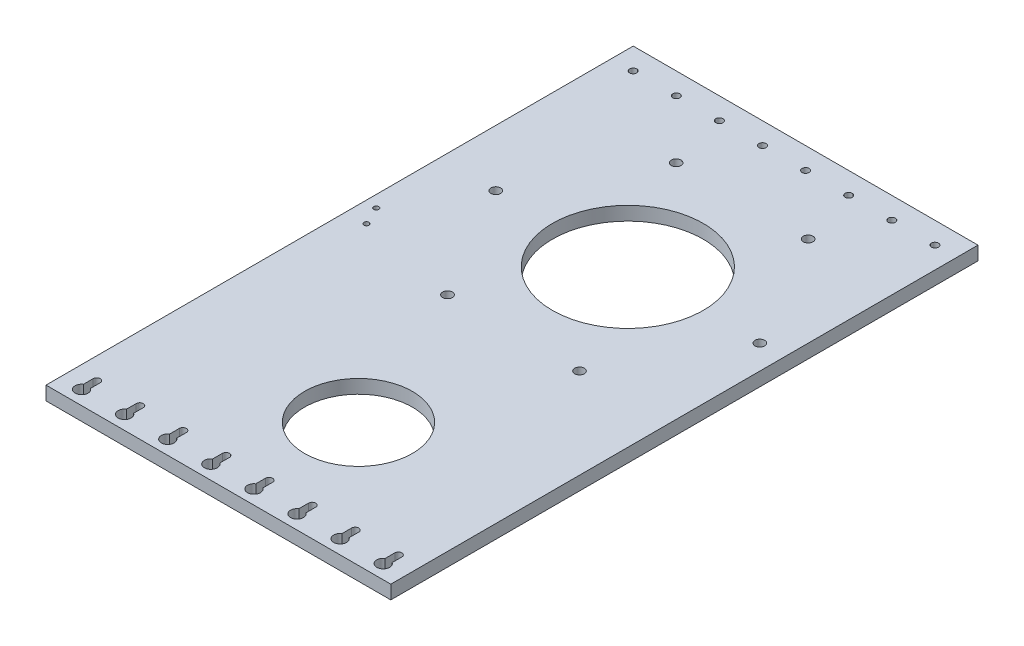
from build123d import *

# Parameters (mm, degrees)
SKETCH1_W           = 160
SKETCH1_H           = 272.5
SKETCH1_R           = 2.25
SKETCH1_R_2         = 25
SKETCH1_R_3         = 1.175
SKETCH1_R_4         = 1.65
SKETCH1_R_5         = 35
BOSS_EXTRUDE1_DEPTH = 6.35
CUT_EXTRUDE1_REACH  = 318.064
SKETCH2_R           = 3


with BuildPart() as part:
    # Sketch1 → Boss-Extrude1 (new body)
    with BuildSketch(Plane(origin=(0, 0, 0), x_dir=(1, 0, 0), z_dir=(0, 1, 0))):
        with Locations((80, 136.25)):
            Rectangle(SKETCH1_W, SKETCH1_H)
        with BuildLine():
            ThreePointArc((11.65, 6.5), (10, 4.85), (8.35, 6.5))
            Line((8.35, 6.5), (8.35, 13.5))
            ThreePointArc((8.35, 13.5), (10, 15.15), (11.65, 13.5))
            Line((11.65, 13.5), (11.65, 6.5))
        make_face(mode=Mode.SUBTRACT)
        with BuildLine():
            Line((31.65, 13.5), (31.65, 6.5))
            ThreePointArc((31.65, 6.5), (30, 4.85), (28.35, 6.5))
            Line((28.35, 6.5), (28.35, 13.5))
            ThreePointArc((28.35, 13.5), (30, 15.15), (31.65, 13.5))
        make_face(mode=Mode.SUBTRACT)
        with BuildLine():
            Line((51.65, 13.5), (51.65, 6.5))
            ThreePointArc((51.65, 6.5), (50, 4.85), (48.35, 6.5))
            Line((48.35, 6.5), (48.35, 13.5))
            ThreePointArc((48.35, 13.5), (50, 15.15), (51.65, 13.5))
        make_face(mode=Mode.SUBTRACT)
        with BuildLine():
            Line((71.65, 13.5), (71.65, 6.5))
            ThreePointArc((71.65, 6.5), (70, 4.85), (68.35, 6.5))
            Line((68.35, 6.5), (68.35, 13.5))
            ThreePointArc((68.35, 13.5), (70, 15.15), (71.65, 13.5))
        make_face(mode=Mode.SUBTRACT)
        with Locations((56.875, 129.455944018)):
            Circle(SKETCH1_R, mode=Mode.SUBTRACT)
        with BuildLine():
            Line((91.65, 13.5), (91.65, 6.5))
            ThreePointArc((91.65, 6.5), (90, 4.85), (88.35, 6.5))
            Line((88.35, 6.5), (88.35, 13.5))
            ThreePointArc((88.35, 13.5), (90, 15.15), (91.65, 13.5))
        make_face(mode=Mode.SUBTRACT)
        with BuildLine():
            Line((111.65, 13.5), (111.65, 6.5))
            ThreePointArc((111.65, 6.5), (110, 4.85), (108.35, 6.5))
            Line((108.35, 6.5), (108.35, 13.5))
            ThreePointArc((108.35, 13.5), (110, 15.15), (111.65, 13.5))
        make_face(mode=Mode.SUBTRACT)
        with Locations((87.5, 57.5)):
            Circle(SKETCH1_R_2, mode=Mode.SUBTRACT)
        with BuildLine():
            Line((131.65, 13.5), (131.65, 6.5))
            ThreePointArc((131.65, 6.5), (130, 4.85), (128.35, 6.5))
            Line((128.35, 6.5), (128.35, 13.5))
            ThreePointArc((128.35, 13.5), (130, 15.15), (131.65, 13.5))
        make_face(mode=Mode.SUBTRACT)
        with BuildLine():
            Line((151.65, 13.5), (151.65, 6.5))
            ThreePointArc((151.65, 6.5), (150, 4.85), (148.35, 6.5))
            Line((148.35, 6.5), (148.35, 13.5))
            ThreePointArc((148.35, 13.5), (150, 15.15), (151.65, 13.5))
        make_face(mode=Mode.SUBTRACT)
        with Locations((118.125, 129.455944018)):
            Circle(SKETCH1_R, mode=Mode.SUBTRACT)
        with Locations((9.516263037, 139.201090269)):
            Circle(SKETCH1_R_3, mode=Mode.SUBTRACT)
        with Locations((5.475532842, 147.798909731)):
            Circle(SKETCH1_R_3, mode=Mode.SUBTRACT)
        with Locations((26.25, 182.5)):
            Circle(SKETCH1_R, mode=Mode.SUBTRACT)
        with Locations((10, 262.5)):
            Circle(SKETCH1_R_4, mode=Mode.SUBTRACT)
        with Locations((30, 262.5)):
            Circle(SKETCH1_R_4, mode=Mode.SUBTRACT)
        with Locations((56.875, 235.544055982)):
            Circle(SKETCH1_R, mode=Mode.SUBTRACT)
        with Locations((50, 262.5)):
            Circle(SKETCH1_R_4, mode=Mode.SUBTRACT)
        with Locations((70, 262.5)):
            Circle(SKETCH1_R_4, mode=Mode.SUBTRACT)
        with Locations((87.5, 182.5)):
            Circle(SKETCH1_R_5, mode=Mode.SUBTRACT)
        with Locations((148.75, 182.5)):
            Circle(SKETCH1_R, mode=Mode.SUBTRACT)
        with Locations((118.125, 235.544055982)):
            Circle(SKETCH1_R, mode=Mode.SUBTRACT)
        with Locations((90, 262.5)):
            Circle(SKETCH1_R_4, mode=Mode.SUBTRACT)
        with Locations((110, 262.5)):
            Circle(SKETCH1_R_4, mode=Mode.SUBTRACT)
        with Locations((130, 262.5)):
            Circle(SKETCH1_R_4, mode=Mode.SUBTRACT)
        with Locations((150, 262.5)):
            Circle(SKETCH1_R_4, mode=Mode.SUBTRACT)
    extrude(amount=BOSS_EXTRUDE1_DEPTH)

    # Sketch2 → Cut-Extrude1 (cut, up to next)
    with BuildSketch(Plane(origin=(0, 6.35, 0), x_dir=(1, 0, 0), z_dir=(0, 1, 0)), mode=Mode.PRIVATE) as cut_extrude1_sk1:
        with Locations((150, 6.5)):
            Circle(SKETCH2_R)
    cut_extrude1_tool1 = extrude(cut_extrude1_sk1.sketch, amount=-CUT_EXTRUDE1_REACH, mode=Mode.PRIVATE) & part.part
    # Sketch2 → Cut-Extrude1 (cut, up to next)
    with BuildSketch(Plane(origin=(0, 6.35, 0), x_dir=(1, 0, 0), z_dir=(0, 1, 0)), mode=Mode.PRIVATE) as cut_extrude1_sk2:
        with Locations((130, 6.5)):
            Circle(SKETCH2_R)
    cut_extrude1_tool2 = extrude(cut_extrude1_sk2.sketch, amount=-CUT_EXTRUDE1_REACH, mode=Mode.PRIVATE) & part.part
    # Sketch2 → Cut-Extrude1 (cut, up to next)
    with BuildSketch(Plane(origin=(0, 6.35, 0), x_dir=(1, 0, 0), z_dir=(0, 1, 0)), mode=Mode.PRIVATE) as cut_extrude1_sk3:
        with Locations((110, 6.5)):
            Circle(SKETCH2_R)
    cut_extrude1_tool3 = extrude(cut_extrude1_sk3.sketch, amount=-CUT_EXTRUDE1_REACH, mode=Mode.PRIVATE) & part.part
    # Sketch2 → Cut-Extrude1 (cut, up to next)
    with BuildSketch(Plane(origin=(0, 6.35, 0), x_dir=(1, 0, 0), z_dir=(0, 1, 0)), mode=Mode.PRIVATE) as cut_extrude1_sk4:
        with Locations((90, 6.5)):
            Circle(SKETCH2_R)
    cut_extrude1_tool4 = extrude(cut_extrude1_sk4.sketch, amount=-CUT_EXTRUDE1_REACH, mode=Mode.PRIVATE) & part.part
    # Sketch2 → Cut-Extrude1 (cut, up to next)
    with BuildSketch(Plane(origin=(0, 6.35, 0), x_dir=(1, 0, 0), z_dir=(0, 1, 0)), mode=Mode.PRIVATE) as cut_extrude1_sk5:
        with Locations((70, 6.5)):
            Circle(SKETCH2_R)
    cut_extrude1_tool5 = extrude(cut_extrude1_sk5.sketch, amount=-CUT_EXTRUDE1_REACH, mode=Mode.PRIVATE) & part.part
    # Sketch2 → Cut-Extrude1 (cut, up to next)
    with BuildSketch(Plane(origin=(0, 6.35, 0), x_dir=(1, 0, 0), z_dir=(0, 1, 0)), mode=Mode.PRIVATE) as cut_extrude1_sk6:
        with Locations((50, 6.5)):
            Circle(SKETCH2_R)
    cut_extrude1_tool6 = extrude(cut_extrude1_sk6.sketch, amount=-CUT_EXTRUDE1_REACH, mode=Mode.PRIVATE) & part.part
    # Sketch2 → Cut-Extrude1 (cut, up to next)
    with BuildSketch(Plane(origin=(0, 6.35, 0), x_dir=(1, 0, 0), z_dir=(0, 1, 0)), mode=Mode.PRIVATE) as cut_extrude1_sk7:
        with Locations((30, 6.5)):
            Circle(SKETCH2_R)
    cut_extrude1_tool7 = extrude(cut_extrude1_sk7.sketch, amount=-CUT_EXTRUDE1_REACH, mode=Mode.PRIVATE) & part.part
    # Sketch2 → Cut-Extrude1 (cut, up to next)
    with BuildSketch(Plane(origin=(0, 6.35, 0), x_dir=(1, 0, 0), z_dir=(0, 1, 0)), mode=Mode.PRIVATE) as cut_extrude1_sk8:
        with Locations((10, 6.5)):
            Circle(SKETCH2_R)
    cut_extrude1_tool8 = extrude(cut_extrude1_sk8.sketch, amount=-CUT_EXTRUDE1_REACH, mode=Mode.PRIVATE) & part.part
    add(cut_extrude1_tool1.solids().sort_by_distance((150, 6.35, -6.5))[0], mode=Mode.SUBTRACT)
    add(cut_extrude1_tool2.solids().sort_by_distance((130, 6.35, -6.5))[0], mode=Mode.SUBTRACT)
    add(cut_extrude1_tool3.solids().sort_by_distance((110, 6.35, -6.5))[0], mode=Mode.SUBTRACT)
    add(cut_extrude1_tool4.solids().sort_by_distance((90, 6.35, -6.5))[0], mode=Mode.SUBTRACT)
    add(cut_extrude1_tool5.solids().sort_by_distance((70, 6.35, -6.5))[0], mode=Mode.SUBTRACT)
    add(cut_extrude1_tool6.solids().sort_by_distance((50, 6.35, -6.5))[0], mode=Mode.SUBTRACT)
    add(cut_extrude1_tool7.solids().sort_by_distance((30, 6.35, -6.5))[0], mode=Mode.SUBTRACT)
    add(cut_extrude1_tool8.solids().sort_by_distance((10, 6.35, -6.5))[0], mode=Mode.SUBTRACT)


solid = part.part
